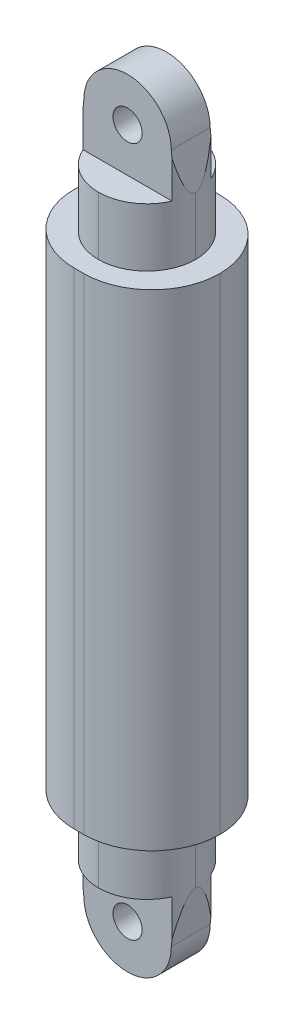
from build123d import *

# Parameters (mm, degrees)
SKETCH2_W                = 10
SKETCH2_H                = 80
BOSS_EXTRUDE1_DEPTH      = 10
FILLET1_R                = 5
CUT_EXTRUDE1_DEPTH       = 3
CUT_EXTRUDE2_START       = 7
SKETCH3_2_W              = 10
SKETCH3_2_H              = 9
CUT_EXTRUDE2_DEPTH       = 3
CUT_EXTRUDE4_START       = -4
CUT_EXTRUDE4_DEPTH       = 46.533119315
SKETCH7_R                = 1.5
CUT_EXTRUDE5_DEPTH       = 41.914545091
BOSS_EXTRUDE2_DEPTH      = 7
BOSS_EXTRUDE2_DEPTH_BACK = 7
SKETCH9_W                = 15
SKETCH9_H                = 50
FILLET3_R                = 7


with BuildPart() as part:
    # Sketch2 → Boss-Extrude1 (new body)
    with BuildSketch(Plane.XY):
        Rectangle(SKETCH2_W, SKETCH2_H)
    extrude(amount=BOSS_EXTRUDE1_DEPTH)

    # Fillet1
    fillet1_edges = [part.edges().sort_by_distance(p)[0] for p in [
        (-5, 0, 0),
        (5, 0, 0),
        (5, 0, 10),
        (-5, 0, 10),
    ]]
    fillet(fillet1_edges, radius=FILLET1_R - 0.0001)  # a hair under: the kernel refuses the full size

    # Sketch3 → Cut-Extrude1 (cut)
    with BuildSketch(Plane.XY):
        with BuildLine():
            Line((-5, -31), (-4.5, -35.5))
            ThreePointArc((-4.5, -35.5), (0, -40), (4.5, -35.5))
            Line((4.5, -35.5), (5, -31))
            Line((5, -31), (-5, -31))
        make_face()
        with BuildLine():
            Line((0, -40), (5, -40))
            Line((5, -40), (5, -31))
            Line((5, -31), (4.5, -35.5))
            ThreePointArc((4.5, -35.5), (3.181980515, -38.681980515), (0, -40))
        make_face()
        with BuildLine():
            Line((-5, -40), (0, -40))
            ThreePointArc((0, -40), (-3.181980515, -38.681980515), (-4.5, -35.5))
            Line((-4.5, -35.5), (-5, -31))
            Line((-5, -31), (-5, -40))
        make_face()
    cut_extrude1 = extrude(amount=CUT_EXTRUDE1_DEPTH, mode=Mode.SUBTRACT)

    # Sketch3<2> → Cut-Extrude2 (cut)
    with BuildSketch(Plane.XY.offset(CUT_EXTRUDE2_START)):
        with Locations((0, -35.5)):
            Rectangle(SKETCH3_2_W, SKETCH3_2_H)
    cut_extrude2 = extrude(amount=CUT_EXTRUDE2_DEPTH, mode=Mode.SUBTRACT)

    # Mirror1: Cut-Extrude1, Cut-Extrude2 across plane
    add(cut_extrude1.mirror(Plane.ZX), mode=Mode.SUBTRACT)
    add(cut_extrude2.mirror(Plane.ZX), mode=Mode.SUBTRACT)

    # Sketch3<4> → Cut-Extrude4 (cut)
    with BuildSketch(Plane.XY.offset(CUT_EXTRUDE4_START)):
        with BuildLine():
            Line((0, -40), (5, -40))
            Line((5, -40), (5, -31))
            Line((5, -31), (4.5, -35.5))
            ThreePointArc((4.5, -35.5), (3.181980515, -38.681980515), (0, -40))
        make_face()
        with BuildLine():
            Line((-5, -40), (0, -40))
            ThreePointArc((0, -40), (-3.181980515, -38.681980515), (-4.5, -35.5))
            Line((-4.5, -35.5), (-5, -31))
            Line((-5, -31), (-5, -40))
        make_face()
    cut_extrude4 = extrude(amount=CUT_EXTRUDE4_DEPTH, mode=Mode.SUBTRACT)

    # Sketch7 → Cut-Extrude5 (cut, through all)
    with BuildSketch(Plane(origin=(0, 0, 3), x_dir=(-1, 0, 0), z_dir=(0, 0, -1))):
        with Locations((0, -35.5)):
            Circle(SKETCH7_R)
    cut_extrude5 = extrude(amount=-CUT_EXTRUDE5_DEPTH, mode=Mode.SUBTRACT)

    # Mirror3: Cut-Extrude5 across plane
    add(cut_extrude5.mirror(Plane.ZX), mode=Mode.SUBTRACT)

    # Mirror4: Cut-Extrude4 across plane
    add(cut_extrude4.mirror(Plane.ZX), mode=Mode.SUBTRACT)

    # Sketch9 → Boss-Extrude2 (add, two sides: drawn at the far end of the back side and taken through both)
    with BuildSketch(Plane.XY.offset(5).offset(-BOSS_EXTRUDE2_DEPTH_BACK)):
        Rectangle(SKETCH9_W, SKETCH9_H)
    extrude(amount=BOSS_EXTRUDE2_DEPTH + BOSS_EXTRUDE2_DEPTH_BACK)

    # Fillet3
    fillet3_edges = [part.edges().sort_by_distance(p)[0] for p in [
        (-7.5, 0, 12),
        (7.5, 0, 12),
        (7.5, 0, -2),
        (-7.5, 0, -2),
    ]]
    fillet(fillet3_edges, radius=FILLET3_R - 0.0001)  # a hair under: the kernel refuses the full size


solid = part.part
